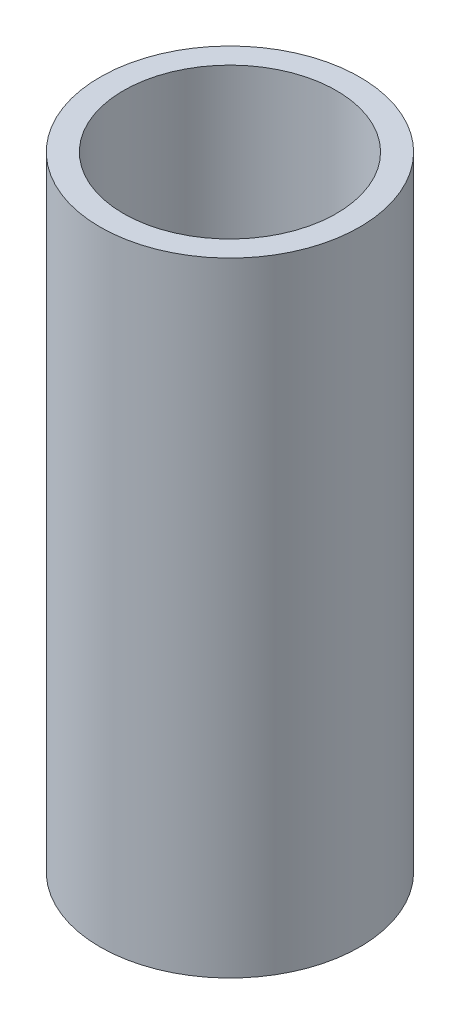
from build123d import *

# Parameters (mm, degrees)
SKETCH1_R           = 3.75
SKETCH1_R_2         = 3.075
BOSS_EXTRUDE1_DEPTH = 18


with BuildPart() as part:
    # Sketch1 → Boss-Extrude1 (new body)
    with BuildSketch(Plane(origin=(0, 0, 0), x_dir=(1, 0, 0), z_dir=(0, 1, 0))):
        Circle(SKETCH1_R)
        Circle(SKETCH1_R_2, mode=Mode.SUBTRACT)
    extrude(amount=BOSS_EXTRUDE1_DEPTH)


solid = part.part
